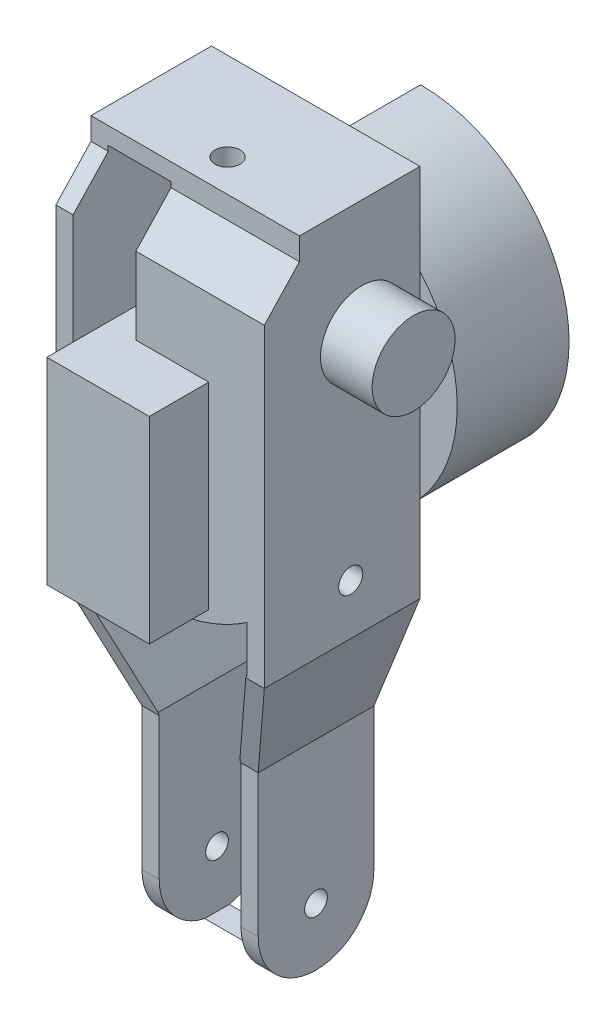
from build123d import *

# Parameters (mm, degrees)
SKETCH_1_W          = 14
SKETCH_1_H          = 2.6
EXTRUDE_1_DEPTH     = 24.22
CUT_EXTRUDE_START   = -5.36
CUT_EXTRUDE_1_DEPTH = 5.36
CUT_EXTRUDE_2_DEPTH = 5.36
CUT_EXTRUDE_3_DEPTH = 51.214587522
SKETCH_6_R          = 4.815
EXTRUDE_3_DEPTH     = 6
EXTRUDE_4_DEPTH     = 13
SKETCH_10_W         = 11.9
SKETCH_10_H         = 22.9
EXTRUDE_5_DEPTH     = 6.9
CUT_EXTRUDE_START_2 = -18.08
CUT_EXTRUDE_4_DEPTH = 18.08
SKETCH_12_R         = 1.315
CUT_EXTRUDE_5_DEPTH = 50.492132708
SKETCH_13_R         = 1.4
CUT_EXTRUDE_6_DEPTH = 55.836301845
SKETCH_14_R         = 1.45
CUT_EXTRUDE_7_DEPTH = 15.9
EXTRUDE_6_DEPTH     = 13


# Read off the part's stored shape, not the designer's step: 切除-拉伸4
with BuildPart() as part:
    # 草图1 → 凸台-拉伸1 (new body)
    with BuildSketch(Plane(origin=(0, 0, 0), x_dir=(0, 0, -1), z_dir=(1, 0, 0))):
        with Locations((2.04, 38.8)):
            Rectangle(SKETCH_1_W, SKETCH_1_H)
        Polygon((-9.04, 33.15), (-9.04, -3.4), (9.04, -3.4), (9.04, 37.5), (-4.96, 37.5), (-4.96, 33.15), align=None)
        Polygon((-4.96, 33.15), (-9.04, 33.15), (-4.96, 37.5), align=None)
        Polygon((9.04, -3.4), (-9.04, -3.4), (-4.39, -16.885), (9.04, -16.885), align=None)
        with BuildLine():
            Line((9.04, -16.885), (-4.39, -16.885))
            Line((-4.39, -16.885), (-4.39, -33.385))
            ThreePointArc((-4.39, -33.385), (2.325, -26.67), (9.04, -33.385))
            Line((9.04, -33.385), (9.04, -16.885))
        make_face()
        with BuildLine():
            ThreePointArc((9.04, -33.385), (2.325, -26.67), (-4.39, -33.385))
            Line((-4.39, -33.385), (9.04, -33.385))
        make_face()
        with BuildLine():
            Line((9.04, -33.385), (-4.39, -33.385))
            ThreePointArc((-4.39, -33.385), (-2.423222036, -38.133222036), (2.325, -40.1))
            ThreePointArc((2.325, -40.1), (7.073222036, -38.133222036), (9.04, -33.385))
        make_face()
        with BuildLine():
            ThreePointArc((9.04, -33.385), (2.325, -26.67), (-4.39, -33.385))
            Line((-4.39, -33.385), (9.04, -33.385))
        make_face()
        with BuildLine():
            Line((9.04, -33.385), (-4.39, -33.385))
            ThreePointArc((-4.39, -33.385), (-2.423222036, -38.133222036), (2.325, -40.1))
            ThreePointArc((2.325, -40.1), (7.073222036, -38.133222036), (9.04, -33.385))
        make_face()
    extrude(amount=EXTRUDE_1_DEPTH)

    # 草图2 → 切除-拉伸1 (cut)
    with BuildSketch(Plane(origin=(24.22, 0, 0), x_dir=(0, 0, -1), z_dir=(1, 0, 0)).offset(CUT_EXTRUDE_START)):
        with BuildLine():
            Line((9.04, -33.385), (9.04, -16.885))
            Line((9.04, -16.885), (-4.39, -16.885))
            Line((-4.39, -16.885), (-4.39, -33.385))
            ThreePointArc((-4.39, -33.385), (2.325, -40.1), (9.04, -33.385))
        make_face()
    extrude(amount=CUT_EXTRUDE_1_DEPTH, mode=Mode.SUBTRACT)

    # 草图3 → 切除-拉伸2 (cut)
    with BuildSketch(Plane.ZY):
        with BuildLine():
            Line((4.39, -16.885), (-9.04, -16.885))
            Line((-9.04, -16.885), (-9.04, -33.385))
            ThreePointArc((-9.04, -33.385), (-2.325, -40.1), (4.39, -33.385))
            Line((4.39, -33.385), (4.39, -16.885))
        make_face()
    extrude(amount=-CUT_EXTRUDE_2_DEPTH, mode=Mode.SUBTRACT)

    # 草图4 → 切除-拉伸3 (cut, through all)
    with BuildSketch(Plane(origin=(0, 0, -9.04), x_dir=(-1, 0, 0), z_dir=(0, 0, -1))):
        Polygon((-18.86, -16.885), (-24.22, -3.4), (-24.22, -16.885), align=None)
        Polygon((0, -16.885), (0, -3.4), (-5.36, -16.885), align=None)
    extrude(amount=-CUT_EXTRUDE_3_DEPTH, mode=Mode.SUBTRACT)

    # 草图6 → 凸台-拉伸3 (add)
    with BuildSketch(Plane(origin=(24.22, 0, 0), x_dir=(0, 0, -1), z_dir=(1, 0, 0))):
        with Locations((2.305, 26.655)):
            Circle(SKETCH_6_R)
    extrude(amount=EXTRUDE_3_DEPTH)

    # 草图8 → 凸台-拉伸4 (add)
    with BuildSketch(Plane(origin=(0, 0, -9.04), x_dir=(-1, 0, 0), z_dir=(0, 0, -1))):
        with BuildLine():
            Line((-11.3, 0.85), (-11.3, 18.1))
            Line((-11.3, 18.1), (-11.3, 35.35))
            ThreePointArc((-11.3, 35.35), (-18.385253719, 33.827736002), (-24.22, 29.529615042))
            Line((-24.22, 29.529615042), (-24.22, 6.670384958))
            ThreePointArc((-24.22, 6.670384958), (-18.385253719, 2.372263998), (-11.3, 0.85))
        make_face()
        with BuildLine():
            Line((-24.22, 6.670384958), (-24.22, 29.529615042))
            ThreePointArc((-24.22, 29.529615042), (-28.55, 18.1), (-24.22, 6.670384958))
        make_face()
    extrude(amount=EXTRUDE_4_DEPTH)

    # 草图10 → 凸台-拉伸5 (add)
    with BuildSketch(Plane.XY.offset(9.04)):
        with Locations((11.81, 12.75)):
            Rectangle(SKETCH_10_W, SKETCH_10_H)
    extrude(amount=EXTRUDE_5_DEPTH)

    # 切除-拉伸4 outline → 切除-拉伸4 (cut)
    with BuildSketch(Plane(origin=(0, 0, -9.04), x_dir=(-1, 0, 0), z_dir=(0, 0, -1)).offset(CUT_EXTRUDE_START_2)):
        with BuildLine():
            Line((-9.3, 24.2), (-5.86, 24.2))
            Line((-5.86, 24.2), (-5.86, 1.3))
            Line((-5.86, 1.3), (-9.3, 1.3))
            Line((-9.3, 1.3), (-9.3, -1.045821999))
            ThreePointArc((-9.3, -1.045821999), (-16.054192627, -0.553690049), (-22.22, 2.247047594))
            Line((-22.22, 2.247047594), (-22.22, -3.017090844))
            Line((-22.22, -3.017090844), (-16.86, -16.502090844))
            Line((-16.86, -16.502090844), (-16.86, -39.946221742))
            Line((-16.86, -39.946221742), (-7.36, -39.946221742))
            Line((-7.36, -39.946221742), (-7.36, -16.502090844))
            Line((-7.36, -16.502090844), (-2, -3.017090844))
            Line((-2, -3.017090844), (-2, 38.1))
            Line((-2, 38.1), (-9.3, 38.1))
            Line((-9.3, 38.1), (-9.3, 24.2))
        make_face()
    extrude(amount=CUT_EXTRUDE_4_DEPTH, mode=Mode.SUBTRACT)

    # 草图12 → 切除-拉伸5 (cut, through all)
    with BuildSketch(Plane(origin=(18.86, 0, 0), x_dir=(0, 0, -1), z_dir=(1, 0, 0))):
        with Locations((2.325, -33.385)):
            Circle(SKETCH_12_R)
    extrude(amount=-CUT_EXTRUDE_5_DEPTH, mode=Mode.SUBTRACT)

    # 草图13 → 切除-拉伸6 (cut, through all)
    with BuildSketch(Plane.ZY):
        with Locations(Location((-1, 2.46, 0), (0, 0, 304.04773237))):
            Circle(SKETCH_13_R)
    extrude(amount=-CUT_EXTRUDE_6_DEPTH, mode=Mode.SUBTRACT)

    # 草图14 → 切除-拉伸7 (cut)
    with BuildSketch(Plane(origin=(0, 40.1, 0), x_dir=(1, 0, 0), z_dir=(0, 1, 0))):
        with Locations(Location((12.11, -1.2, 0), (0, 0, 270))):
            Circle(SKETCH_14_R)
    extrude(amount=-CUT_EXTRUDE_7_DEPTH, mode=Mode.SUBTRACT)

    # 草图15 → 凸台-拉伸6 (add)
    with BuildSketch(Plane(origin=(0, 0, -22.04), x_dir=(-1, 0, 0), z_dir=(0, 0, -1))):
        with BuildLine():
            ThreePointArc((-11.3, 21.71), (-14.91, 18.1), (-11.3, 14.49))
            Line((-11.3, 14.49), (-11.3, 21.71))
        make_face()
        with BuildLine():
            Line((-11.3, 21.71), (-11.3, 14.49))
            ThreePointArc((-11.3, 14.49), (-8.74734452, 15.54734452), (-7.69, 18.1))
            ThreePointArc((-7.69, 18.1), (-8.74734452, 20.65265548), (-11.3, 21.71))
        make_face()
    extrude(amount=-EXTRUDE_6_DEPTH)


solid = part.part
